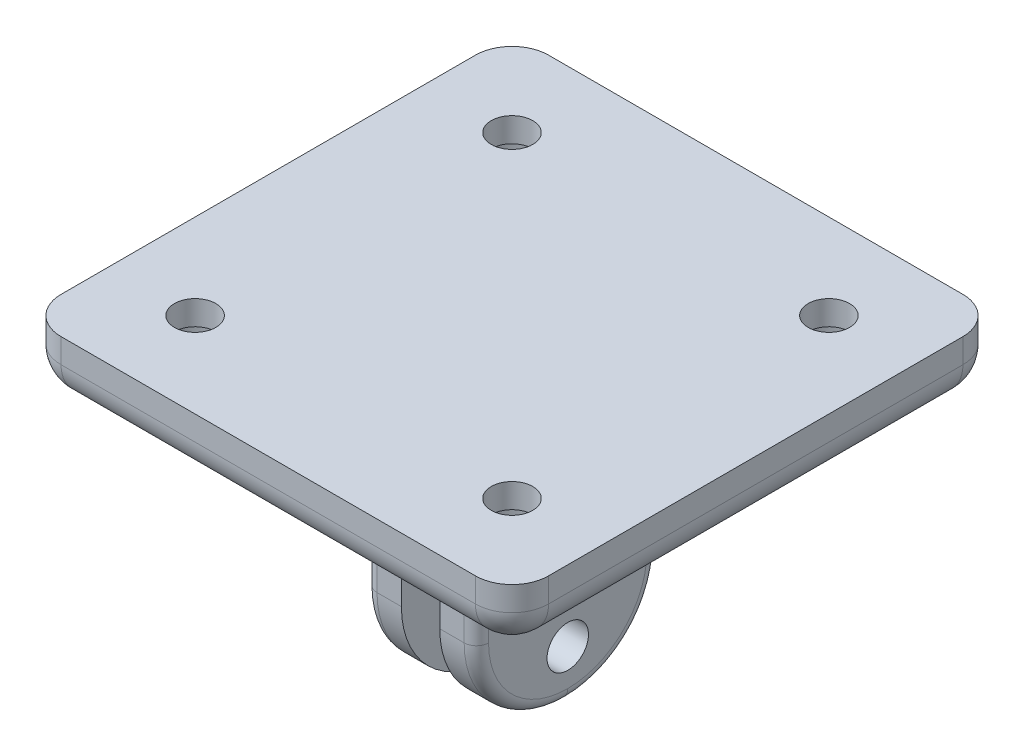
from build123d import *

# Parameters (mm, degrees)
SKETCH1_W                      = 3
SKETCH1_H                      = 15
BOSS_EXTRUDE1_DEPTH            = 20.225
BOSS_EXTRUDE1_2_DEPTH          = 20.225
SKETCH2_W                      = 40
SKETCH2_H                      = 40
BOSS_EXTRUDE2_DEPTH            = 5
M3_CLEARANCE_HOLE1_D           = 3.4
FILLET1_R                      = 7.5
FILLET3_R                      = 1
CBORE_FOR_M3_SHCS1_D           = 3.4
CBORE_FOR_M3_SHCS1_CBORE_D     = 6.5
CBORE_FOR_M3_SHCS1_CBORE_DEPTH = 3
FILLET5_R                      = 3


with BuildPart() as part:
    # Sketch1 → Boss-Extrude1 (new body)
    with BuildSketch(Plane(origin=(0, 0, 0), x_dir=(1, 0, 0), z_dir=(0, 1, 0))):
        with Locations((-3.075, 0)):
            Rectangle(SKETCH1_W, SKETCH1_H)
    extrude(amount=BOSS_EXTRUDE1_DEPTH)



with BuildPart() as body_2:
    # Sketch1 → Boss-Extrude1 2 (new body)
    with BuildSketch(Plane(origin=(0, 0, 0), x_dir=(1, 0, 0), z_dir=(0, 1, 0))):
        with Locations((3.075, 0)):
            Rectangle(SKETCH1_W, SKETCH1_H)
    extrude(amount=BOSS_EXTRUDE1_2_DEPTH)


with BuildPart() as part_1:
    add(part.part)

    add(body_2.part)  # Boss-Extrude2 merges body 2
    # Sketch2 → Boss-Extrude2 (add)
    with BuildSketch(Plane(origin=(0, 20.225, 0), x_dir=(1, 0, 0), z_dir=(0, 1, 0))):
        Rectangle(SKETCH2_W, SKETCH2_H)
    extrude(amount=BOSS_EXTRUDE2_DEPTH)

    # M3 Clearance Hole1 (through all)
    with Locations(Plane.ZY.offset(4.575)):
        with Locations((0, 11), (0, 4)):
            Hole(M3_CLEARANCE_HOLE1_D / 2)

    # Fillet1
    fillet1_edges = [part_1.edges().sort_by_distance(p)[0] for p in [
        (3.075, 0, 7.5),
        (-3.075, 0, 7.5),
        (-3.075, 0, -7.5),
        (3.075, 0, -7.5),
    ]]
    fillet(fillet1_edges, radius=FILLET1_R - 0.0001)  # a hair under: the kernel refuses the full size

    # Fillet3
    fillet3_edges = [part_1.edges().sort_by_distance(p)[0] for p in [
        (-3.075, 20.225, -7.5),
        (4.575, 13.86245, 7.5),
        (4.575, 13.86245, -7.5),
        (3.075, 20.225, 7.5),
        (4.575, 20.225, 0),
        (3.075, 20.225, -7.5),
        (-4.575, 20.225, 0),
        (4.575, 2.196669852, -5.303330148),
        (4.575, 2.196669852, 5.303330148),
        (-4.575, 2.196669852, -5.303330148),
        (-4.575, 2.196669852, 5.303330148),
        (-4.575, 13.86245, -7.5),
        (-4.575, 13.86245, 7.5),
        (-3.075, 20.225, 7.5),
    ]]
    fillet(fillet3_edges, radius=FILLET3_R)

    # CBORE for M3 SHCS1 (through all)
    with Locations(Plane(origin=(0, 20.225, 0), x_dir=(-1, 0, 0), z_dir=(0, -1, 0))):
        with Locations((-13, -13), (-13, 13), (13, 13), (13, -13)):
            CounterBoreHole(CBORE_FOR_M3_SHCS1_D / 2, CBORE_FOR_M3_SHCS1_CBORE_D / 2, CBORE_FOR_M3_SHCS1_CBORE_DEPTH)

    # Fillet5
    fillet5_edges = [part_1.edges().sort_by_distance(p)[0] for p in [
        (-20, 20.225, 0),
        (-20, 22.725, -20),
        (0, 20.225, 20),
        (-20, 22.725, 20),
        (20, 20.225, 0),
        (20, 22.725, 20),
        (0, 20.225, -20),
        (20, 22.725, -20),
    ]]
    fillet(fillet5_edges, radius=FILLET5_R)


solid = part_1.part
